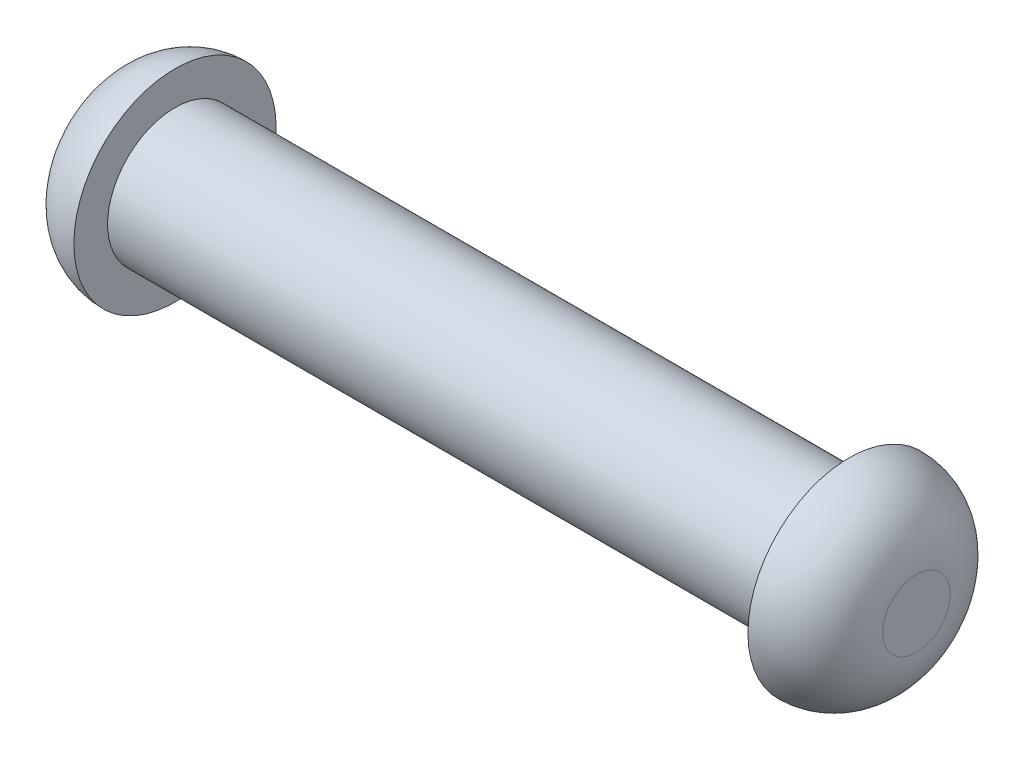
from build123d import *

# Parameters (mm, degrees)
FILLET1_R = 1


with BuildPart() as part:
    # Sketch2 → Revolve1 (revolve)
    with BuildSketch(Plane.XY, mode=Mode.PRIVATE) as revolve1_sk:
        Polygon((1, 1), (11, 1), (11, 1.5), (12, 1.5), (12, 0), (0, 0), (0, 1.5), (1, 1.5), align=None)
    revolve(revolve1_sk.sketch.rotate(Axis((12, 0, 0), (-1, 0, 0)), 90), axis=Axis((12, 0, 0), (-1, 0, 0)))

    # Fillet1
    fillet1_edges = [part.edges().sort_by_distance(p)[0] for p in [
        (0, 0, 1.5),
        (12, 0, 1.5),
    ]]
    fillet(fillet1_edges, radius=FILLET1_R - 0.0001)  # a hair under: the kernel refuses the full size


solid = part.part
